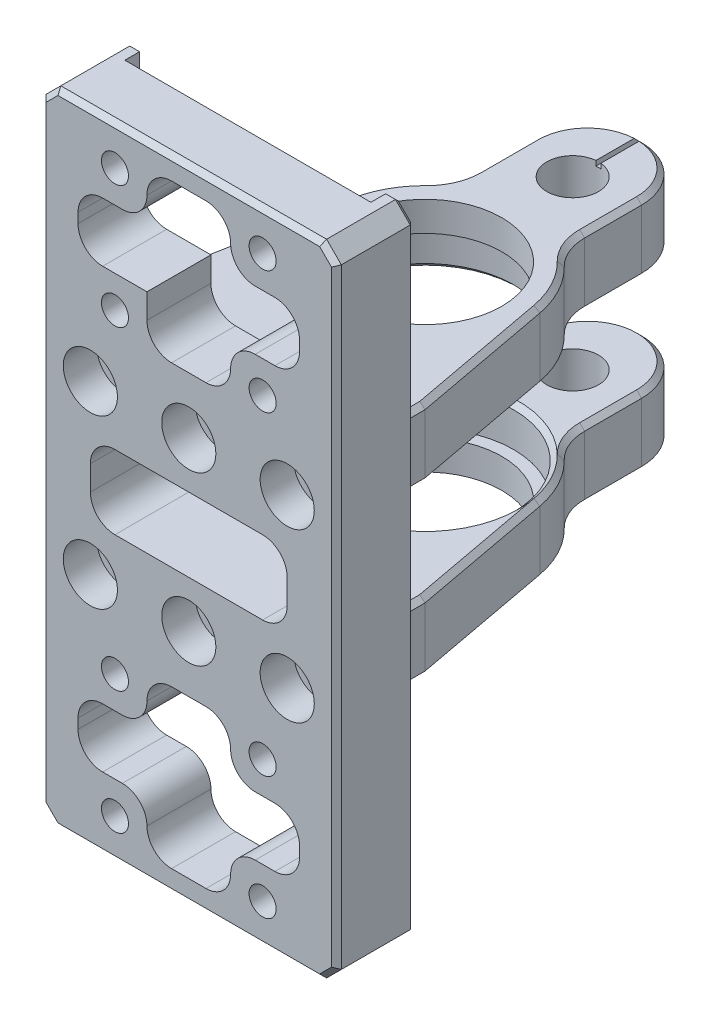
from build123d import *

# Parameters (mm, degrees)
SKETCH_1_W                  = 60
SKETCH_1_H                  = 130
EXTRUDE_1_DEPTH             = 16
SKETCH_2_W                  = 50
SKETCH_2_H                  = 55
CUT_EXTRUDE_1_DEPTH         = 3
SKETCH_14_R                 = 2.5
CUT_EXTRUDE_5_DEPTH         = 3
EXTRUDE_2_DEPTH             = 14
EXTRUDE_3_DEPTH             = 14
FILLET_1_R                  = 10
SKETCH_5_R                  = 18
CUT_EXTRUDE_2_DEPTH         = 8
SKETCH_6_R                  = 15.6
CUT_EXTRUDE_3_DEPTH         = 117.468879964
CUT_EXTRUDE_4_DEPTH         = 1
HOLE_WIZARD_1_AT_2_COUNT    = 2
HOLE_WIZARD_1_AT_2_PITCH    = 40
HOLE_WIZARD_1_AT_3_COUNT    = 2
HOLE_WIZARD_1_AT_3_PITCH    = 20
HOLE_WIZARD_1_AT_4_COUNT    = 2
HOLE_WIZARD_1_AT_4_PITCH    = 34
HOLE_WIZARD_1_AT_5_COUNT    = 2
HOLE_WIZARD_1_AT_5_PITCH    = 52.497618994
HOLE_WIZARD_1_AT_6_COUNT    = 2
HOLE_WIZARD_1_AT_6_PITCH    = 39.446165847
HOLE_WIZARD_M6_1_AT_2_COUNT = 2
HOLE_WIZARD_M6_1_AT_2_PITCH = 20
HOLE_WIZARD_M6_1_AT_3_COUNT = 2
HOLE_WIZARD_M6_1_AT_3_PITCH = 40
HOLE_WIZARD_M6_2_AT_2_COUNT = 2
HOLE_WIZARD_M6_2_AT_2_PITCH = 20
HOLE_WIZARD_M6_2_AT_3_COUNT = 2
HOLE_WIZARD_M6_2_AT_3_PITCH = 40
HOLE_WIZARD_2_AT_2_COUNT    = 2
HOLE_WIZARD_2_AT_2_PITCH    = 30
HOLE_WIZARD_2_AT_3_COUNT    = 2
HOLE_WIZARD_2_AT_3_PITCH    = 114
HOLE_WIZARD_2_AT_4_COUNT    = 2
HOLE_WIZARD_2_AT_4_PITCH    = 117.881296226
HOLE_WIZARD_2_AT_5_COUNT    = 2
HOLE_WIZARD_2_AT_5_PITCH    = 39.05124838
HOLE_WIZARD_2_AT_6_COUNT    = 2
HOLE_WIZARD_2_AT_6_PITCH    = 25
HOLE_WIZARD_2_AT_7_COUNT    = 2
HOLE_WIZARD_2_AT_7_PITCH    = 89
HOLE_WIZARD_2_AT_8_COUNT    = 2
HOLE_WIZARD_2_AT_8_PITCH    = 93.920178875
SKETCH_25_W                 = 17
SKETCH_25_H                 = 10
SKETCH_25_H_2               = 12
SKETCH_25_W_2               = 14
SKETCH_25_W_3               = 40
SKETCH_25_H_3               = 15
CUT_EXTRUDE_6_DEPTH         = 105.407854111
FILLET_2_R                  = 5
CHAMFER_1_SIZE              = 3
CHAMFER_2_SIZE              = 1
CHAMFER_3_SIZE              = 1
CHAMFER_4_SIZE              = 1


with BuildPart() as part:
    # 草图1 → 凸台-拉伸1 (new body)
    with BuildSketch(Plane.XY):
        Rectangle(SKETCH_1_W, SKETCH_1_H)
    extrude(amount=EXTRUDE_1_DEPTH)

    # 草图2 → 切除-拉伸1 (cut)
    with BuildSketch(Plane(origin=(0, 0, 0), x_dir=(-1, 0, 0), z_dir=(0, 0, -1))):
        with Locations((0, -37.5)):
            Rectangle(SKETCH_2_W, SKETCH_2_H)
        with Locations((0, 37.5)):
            Rectangle(SKETCH_2_W, SKETCH_2_H)
    extrude(amount=-CUT_EXTRUDE_1_DEPTH, mode=Mode.SUBTRACT)

    # 草图14 → 切除-拉伸5 (cut)
    with BuildSketch(Plane(origin=(0, 0, 0), x_dir=(-1, 0, 0), z_dir=(0, 0, -1))):
        with Locations((-25, -10)):
            Circle(SKETCH_14_R)
        with Locations((-25, 10)):
            Circle(SKETCH_14_R)
        with Locations((25, 10)):
            Circle(SKETCH_14_R)
        with Locations((25, -10)):
            Circle(SKETCH_14_R)
    extrude(amount=-CUT_EXTRUDE_5_DEPTH, mode=Mode.SUBTRACT)

    # 草图17 → 打孔尺寸(%根据)内六角圆柱头螺钉的类型1 (revolve, cut)
    with BuildSketch(Plane(origin=(-20, -17, 16), x_dir=(0, -1, 0), z_dir=(1, 0, 0))):
        Polygon((0, 0), (0, 30.482840043), (3.3, 28.5), (3.3, 6.8), (5.5, 6.8), (5.5, 0), align=None)
    hole_wizard_1 = revolve(axis=Axis((-20, -17, 22.35), (0, 0, -1)), mode=Mode.SUBTRACT)

    # 打孔尺寸(%根据)内六角圆柱头螺钉的类型1 at 2: 打孔尺寸(%根据)内六角圆柱头螺钉的类型1 ×2
    with Locations(*[(i * HOLE_WIZARD_1_AT_2_PITCH, 0, 0) for i in range(1, HOLE_WIZARD_1_AT_2_COUNT)]):
        add(hole_wizard_1, mode=Mode.SUBTRACT)

    # 打孔尺寸(%根据)内六角圆柱头螺钉的类型1 at 3: 打孔尺寸(%根据)内六角圆柱头螺钉的类型1 ×2
    with Locations(*[(i * HOLE_WIZARD_1_AT_3_PITCH, 0, 0) for i in range(1, HOLE_WIZARD_1_AT_3_COUNT)]):
        add(hole_wizard_1, mode=Mode.SUBTRACT)

    # 打孔尺寸(%根据)内六角圆柱头螺钉的类型1 at 4: 打孔尺寸(%根据)内六角圆柱头螺钉的类型1 ×2
    with Locations(*[(0, i * HOLE_WIZARD_1_AT_4_PITCH, 0) for i in range(1, HOLE_WIZARD_1_AT_4_COUNT)]):
        add(hole_wizard_1, mode=Mode.SUBTRACT)

    # 打孔尺寸(%根据)内六角圆柱头螺钉的类型1 at 5: 打孔尺寸(%根据)内六角圆柱头螺钉的类型1 ×2
    with Locations(*[Vector(0.7619393177594593, 0.6476484200955406, 0) * (i * HOLE_WIZARD_1_AT_5_PITCH) for i in range(1, HOLE_WIZARD_1_AT_5_COUNT)]):
        add(hole_wizard_1, mode=Mode.SUBTRACT)

    # 打孔尺寸(%根据)内六角圆柱头螺钉的类型1 at 6: 打孔尺寸(%根据)内六角圆柱头螺钉的类型1 ×2
    with Locations(*[Vector(0.507020126563394, 0.8619342151577695, 0) * (i * HOLE_WIZARD_1_AT_6_PITCH) for i in range(1, HOLE_WIZARD_1_AT_6_COUNT)]):
        add(hole_wizard_1, mode=Mode.SUBTRACT)

    # 草图24 → 打孔尺寸(%根据)内六角圆柱头螺钉的类型2 (revolve, cut)
    with BuildSketch(Plane(origin=(15, -57, 3), x_dir=(0, 1, 0), z_dir=(1, 0, 0))):
        Polygon((0, 0), (0, 16.652366702), (2.75, 15), (2.75, 5.7), (5, 5.7), (5, 0), align=None)
    hole_wizard_2 = revolve(axis=Axis((15, -57, -3.35), (0, 0, 1)), mode=Mode.SUBTRACT)

    # 打孔尺寸(%根据)内六角圆柱头螺钉的类型2 at 2: 打孔尺寸(%根据)内六角圆柱头螺钉的类型2 ×2
    with Locations(*[(-i * HOLE_WIZARD_2_AT_2_PITCH, 0, 0) for i in range(1, HOLE_WIZARD_2_AT_2_COUNT)]):
        add(hole_wizard_2, mode=Mode.SUBTRACT)

    # 打孔尺寸(%根据)内六角圆柱头螺钉的类型2 at 3: 打孔尺寸(%根据)内六角圆柱头螺钉的类型2 ×2
    with Locations(*[(0, i * HOLE_WIZARD_2_AT_3_PITCH, 0) for i in range(1, HOLE_WIZARD_2_AT_3_COUNT)]):
        add(hole_wizard_2, mode=Mode.SUBTRACT)

    # 打孔尺寸(%根据)内六角圆柱头螺钉的类型2 at 4: 打孔尺寸(%根据)内六角圆柱头螺钉的类型2 ×2
    with Locations(*[Vector(-0.25449329927964387, 0.9670745372626465, 0) * (i * HOLE_WIZARD_2_AT_4_PITCH) for i in range(1, HOLE_WIZARD_2_AT_4_COUNT)]):
        add(hole_wizard_2, mode=Mode.SUBTRACT)

    # 打孔尺寸(%根据)内六角圆柱头螺钉的类型2 at 5: 打孔尺寸(%根据)内六角圆柱头螺钉的类型2 ×2
    with Locations(*[Vector(-0.7682212795973759, 0.6401843996644799, 0) * (i * HOLE_WIZARD_2_AT_5_PITCH) for i in range(1, HOLE_WIZARD_2_AT_5_COUNT)]):
        add(hole_wizard_2, mode=Mode.SUBTRACT)

    # 打孔尺寸(%根据)内六角圆柱头螺钉的类型2 at 6: 打孔尺寸(%根据)内六角圆柱头螺钉的类型2 ×2
    with Locations(*[(0, i * HOLE_WIZARD_2_AT_6_PITCH, 0) for i in range(1, HOLE_WIZARD_2_AT_6_COUNT)]):
        add(hole_wizard_2, mode=Mode.SUBTRACT)

    # 打孔尺寸(%根据)内六角圆柱头螺钉的类型2 at 7: 打孔尺寸(%根据)内六角圆柱头螺钉的类型2 ×2
    with Locations(*[(0, i * HOLE_WIZARD_2_AT_7_PITCH, 0) for i in range(1, HOLE_WIZARD_2_AT_7_COUNT)]):
        add(hole_wizard_2, mode=Mode.SUBTRACT)

    # 打孔尺寸(%根据)内六角圆柱头螺钉的类型2 at 8: 打孔尺寸(%根据)内六角圆柱头螺钉的类型2 ×2
    with Locations(*[Vector(-0.3194201752935104, 0.9476131867040809, 0) * (i * HOLE_WIZARD_2_AT_8_PITCH) for i in range(1, HOLE_WIZARD_2_AT_8_COUNT)]):
        add(hole_wizard_2, mode=Mode.SUBTRACT)

    # 草图25 → 切除-拉伸6 (cut, through all)
    with BuildSketch(Plane(origin=(0, 0, 0), x_dir=(-1, 0, 0), z_dir=(0, 0, -1))):
        with Locations((0, -33.5)):
            Rectangle(SKETCH_25_W, SKETCH_25_H)
        with Locations((0, -44.5)):
            Rectangle(SKETCH_25_W, SKETCH_25_H_2)
        with Locations((-15.5, -44.5)):
            Rectangle(SKETCH_25_W_2, SKETCH_25_H_2)
        with Locations((0, -55.5)):
            Rectangle(SKETCH_25_W, SKETCH_25_H)
        with Locations((15.5, -44.5)):
            Rectangle(SKETCH_25_W_2, SKETCH_25_H_2)
        Rectangle(SKETCH_25_W_3, SKETCH_25_H_3)
        with Locations((0, 33.5)):
            Rectangle(SKETCH_25_W, SKETCH_25_H)
        with Locations((-15.5, 44.5)):
            Rectangle(SKETCH_25_W_2, SKETCH_25_H_2)
        with Locations((0, 44.5)):
            Rectangle(SKETCH_25_W, SKETCH_25_H_2)
        with Locations((15.5, 44.5)):
            Rectangle(SKETCH_25_W_2, SKETCH_25_H_2)
        with Locations((0, 55.5)):
            Rectangle(SKETCH_25_W, SKETCH_25_H)
    extrude(amount=-CUT_EXTRUDE_6_DEPTH, mode=Mode.SUBTRACT)

    # 圆角2
    fillet_2_edges = [part.edges().sort_by_distance(p)[0] for p in [
        (22.5, 50.5, 9.5),
        (8.5, 50.5, 9.5),
        (8.5, 60.5, 9.5),
        (-8.5, 60.5, 9.5),
        (-8.5, 50.5, 9.5),
        (-22.5, 50.5, 9.5),
        (-22.5, 38.5, 9.5),
        (-8.5, 28.5, 9.5),
        (8.5, 28.5, 9.5),
        (8.5, 38.5, 9.5),
        (22.5, 38.5, 9.5),
        (8.5, -38.5, 9.5),
        (8.5, -28.5, 9.5),
        (-8.5, -38.5, 9.5),
        (-8.5, -28.5, 9.5),
        (-22.5, -38.5, 9.5),
        (-22.5, -50.5, 9.5),
        (-8.5, -50.5, 9.5),
        (-8.5, -60.5, 9.5),
        (8.5, -60.5, 9.5),
        (8.5, -50.5, 9.5),
        (22.5, -50.5, 9.5),
        (22.5, -38.5, 9.5),
        (-20, -7.5, 8),
        (-20, 7.5, 8),
        (20, 7.5, 8),
        (20, -7.5, 8),
    ]]
    fillet(fillet_2_edges, radius=FILLET_2_R - 0.0001)  # a hair under: the kernel refuses the full size

    # 倒角1
    chamfer_1_edges = [part.edges().sort_by_distance(p)[0] for p in [
        (30, -65, 8),
        (-30, -65, 8),
        (-30, 65, 8),
        (30, 65, 8),
    ]]
    chamfer(chamfer_1_edges, length=CHAMFER_1_SIZE)

    # 倒角2
    chamfer_2_edges = [part.edges().sort_by_distance(p)[0] for p in [
        (26, -65, 0),
        (-26, 65, 0),
        (0, -65, 3),
        (-25, -38.75, 0),
        (0, 65, 3),
        (25, 38.75, 0),
        (0, -10, 0),
        (25, -38.75, 0),
        (-30, 0, 0),
        (-30, 0, 16),
        (-26, -65, 0),
        (26, 65, 0),
        (30, 0, 0),
        (28.5, -63.5, 0),
        (-28.5, -63.5, 0),
        (28.5, 63.5, 0),
        (-28.5, 63.5, 0),
        (0, 65, 16),
        (30, 0, 16),
        (0, -65, 16),
        (28.5, -63.5, 16),
        (-28.5, -63.5, 16),
        (28.5, 63.5, 16),
        (-28.5, 63.5, 16),
        (0, 10, 0),
        (-25, 38.75, 0),
    ]]
    chamfer(chamfer_2_edges, length=CHAMFER_2_SIZE)


with BuildPart() as body_2:
    # 草图4 → 凸台-拉伸2 (new body)
    with BuildSketch(Plane(origin=(0, 10, 0), x_dir=(1, 0, 0), z_dir=(0, 1, 0))):
        with BuildLine():
            Line((25, -3), (25, 7))
            Line((25, 7), (19.66190379, 35.66190379))
            ThreePointArc((19.66190379, 35.66190379), (0, 52), (-19.66190379, 35.66190379))
            Line((-19.66190379, 35.66190379), (-25, 7))
            Line((-25, 7), (-25, -3))
            Line((-25, -3), (25, -3))
        make_face()
    extrude(amount=EXTRUDE_2_DEPTH)

    # 草图7 → 凸台-拉伸3 (add)
    with BuildSketch(Plane(origin=(0, 24, 0), x_dir=(1, 0, 0), z_dir=(0, 1, 0))):
        with BuildLine():
            Line((-11, 39), (-11, 65))
            ThreePointArc((-11, 65), (0, 76), (11, 65))
            Line((11, 65), (11, 39))
            ThreePointArc((11, 39), (0, 28), (-11, 39))
        make_face()
    extrude(amount=-EXTRUDE_3_DEPTH)

    # 圆角1
    fillet_1_edges = [body_2.edges().sort_by_distance(p)[0] for p in [
        (-11, 17, -48.703293088),
        (11, 17, -48.703293088),
    ]]
    fillet(fillet_1_edges, radius=FILLET_1_R)

    # 草图5 → 切除-拉伸2 (cut)
    with BuildSketch(Plane.XZ.offset(-10)):
        with Locations((0, -32)):
            Circle(SKETCH_5_R)
    extrude(amount=-CUT_EXTRUDE_2_DEPTH, mode=Mode.SUBTRACT)

    # 草图6 → 切除-拉伸3 (cut, through all)
    with BuildSketch(Plane.XZ.offset(-18)):
        with Locations((0, -32)):
            Circle(SKETCH_6_R)
    extrude(amount=-CUT_EXTRUDE_3_DEPTH, mode=Mode.SUBTRACT)

    # 草图12 → M12x1.5 螺纹孔1 (revolve, cut)
    with BuildSketch(Plane(origin=(0, 24, -62), x_dir=(0, 0, 1), z_dir=(1, 0, 0))):
        Polygon((0, 0), (0, 31.65451825), (5.25, 28.5), (5.25, 0), align=None)
    revolve(axis=Axis((0, 30.35, -62), (0, -1, 0)), mode=Mode.SUBTRACT)

    # 草图13 → 切除-拉伸4 (cut)
    with BuildSketch(Plane(origin=(0, 24, 0), x_dir=(1, 0, 0), z_dir=(0, 1, 0))):
        with BuildLine():
            Line((0.5, 84.75), (0.5, 67.25))
            ThreePointArc((0.5, 67.25), (0, 66.75), (-0.5, 67.25))
            Line((-0.5, 67.25), (-0.5, 84.75))
            ThreePointArc((-0.5, 84.75), (0, 85.25), (0.5, 84.75))
        make_face()
    extrude(amount=-CUT_EXTRUDE_4_DEPTH, mode=Mode.SUBTRACT)


with BuildPart() as body_3:
    # 镜向2: mirrored copy
    add(body_2.part.mirror(Plane.ZX))

    # 草图19 → M6 螺纹孔1 (revolve, cut)
    with BuildSketch(Plane(origin=(-20, -17, 3), x_dir=(0, -1, 0), z_dir=(1, 0, 0))):
        Polygon((0, 0), (0, 16.502151548), (2.5, 15), (2.5, 0), align=None)
    hole_wizard_m6_1 = revolve(axis=Axis((-20, -17, 9.35), (0, 0, -1)), mode=Mode.SUBTRACT)

    # M6 螺纹孔1 at 2: M6 螺纹孔1 ×2
    with Locations(*[(i * HOLE_WIZARD_M6_1_AT_2_PITCH, 0, 0) for i in range(1, HOLE_WIZARD_M6_1_AT_2_COUNT)]):
        add(hole_wizard_m6_1, mode=Mode.SUBTRACT)

    # M6 螺纹孔1 at 3: M6 螺纹孔1 ×2
    with Locations(*[(i * HOLE_WIZARD_M6_1_AT_3_PITCH, 0, 0) for i in range(1, HOLE_WIZARD_M6_1_AT_3_COUNT)]):
        add(hole_wizard_m6_1, mode=Mode.SUBTRACT)

    # 倒角4
    chamfer_4_edges = [body_3.edges().sort_by_distance(p)[0] for p in [
        (25, -10, -2),
        (-25, -10, -2),
        (-18, -10, -32),
        (-22.330951895, -10, -21.330951895),
        (-17.648855564, -10, -41.408395044),
        (-11.780455543, -10, -49.551301939),
        (22.330951895, -10, -21.330951895),
        (-11, -10, -59.212142643),
        (17.648855564, -10, -41.408395044),
        (0, -10, -76),
        (11.780455543, -10, -49.551301939),
        (11, -10, -59.212142643),
        (7.95298686, -24, -72.599342077),
        (11, -24, -59.212142643),
        (11.780455543, -24, -49.551301939),
        (17.648855564, -24, -41.408395044),
        (22.330951895, -24, -21.330951895),
        (25, -24, -2),
        (-7.95298686, -24, -72.599342077),
        (-11, -24, -59.212142643),
        (-11.780455543, -24, -49.551301939),
        (-17.648855564, -24, -41.408395044),
        (-25, -24, -2),
        (-22.330951895, -24, -21.330951895),
    ]]
    chamfer(chamfer_4_edges, length=CHAMFER_4_SIZE - 0.0001)  # a hair under: the kernel refuses the full size


with BuildPart() as body_2_1:
    add(body_2.part)

    # 草图21 → M6 螺纹孔2 (revolve, cut)
    with BuildSketch(Plane(origin=(-20, 17, 3), x_dir=(0, -1, 0), z_dir=(1, 0, 0))):
        Polygon((0, 0), (0, 16.502151548), (2.5, 15), (2.5, 0), align=None)
    hole_wizard_m6_2 = revolve(axis=Axis((-20, 17, 9.35), (0, 0, -1)), mode=Mode.SUBTRACT)

    # M6 螺纹孔2 at 2: M6 螺纹孔2 ×2
    with Locations(*[(i * HOLE_WIZARD_M6_2_AT_2_PITCH, 0, 0) for i in range(1, HOLE_WIZARD_M6_2_AT_2_COUNT)]):
        add(hole_wizard_m6_2, mode=Mode.SUBTRACT)

    # M6 螺纹孔2 at 3: M6 螺纹孔2 ×2
    with Locations(*[(i * HOLE_WIZARD_M6_2_AT_3_PITCH, 0, 0) for i in range(1, HOLE_WIZARD_M6_2_AT_3_COUNT)]):
        add(hole_wizard_m6_2, mode=Mode.SUBTRACT)

    # 倒角3
    chamfer_3_edges = [body_2_1.edges().sort_by_distance(p)[0] for p in [
        (25, 24, -2),
        (25, 10, -2),
        (22.330951895, 24, -21.330951895),
        (17.648855564, 24, -41.408395044),
        (11.780455543, 24, -49.551301939),
        (11, 24, -59.212142643),
        (11, 10, -59.212142643),
        (7.95298686, 24, -72.599342077),
        (-7.95298686, 24, -72.599342077),
        (-11, 10, -59.212142643),
        (-11, 24, -59.212142643),
        (-11.780455543, 24, -49.551301939),
        (-17.648855564, 24, -41.408395044),
        (-25, 24, -2),
        (-22.330951895, 24, -21.330951895),
        (22.330951895, 10, -21.330951895),
        (17.648855564, 10, -41.408395044),
        (11.780455543, 10, -49.551301939),
        (0, 10, -76),
        (-11.780455543, 10, -49.551301939),
        (-17.648855564, 10, -41.408395044),
        (-25, 10, -2),
        (-22.330951895, 10, -21.330951895),
        (-18, 10, -32),
    ]]
    chamfer(chamfer_3_edges, length=CHAMFER_3_SIZE - 0.0001)  # a hair under: the kernel refuses the full size


solid = Compound([part.part, body_3.part, body_2_1.part])
